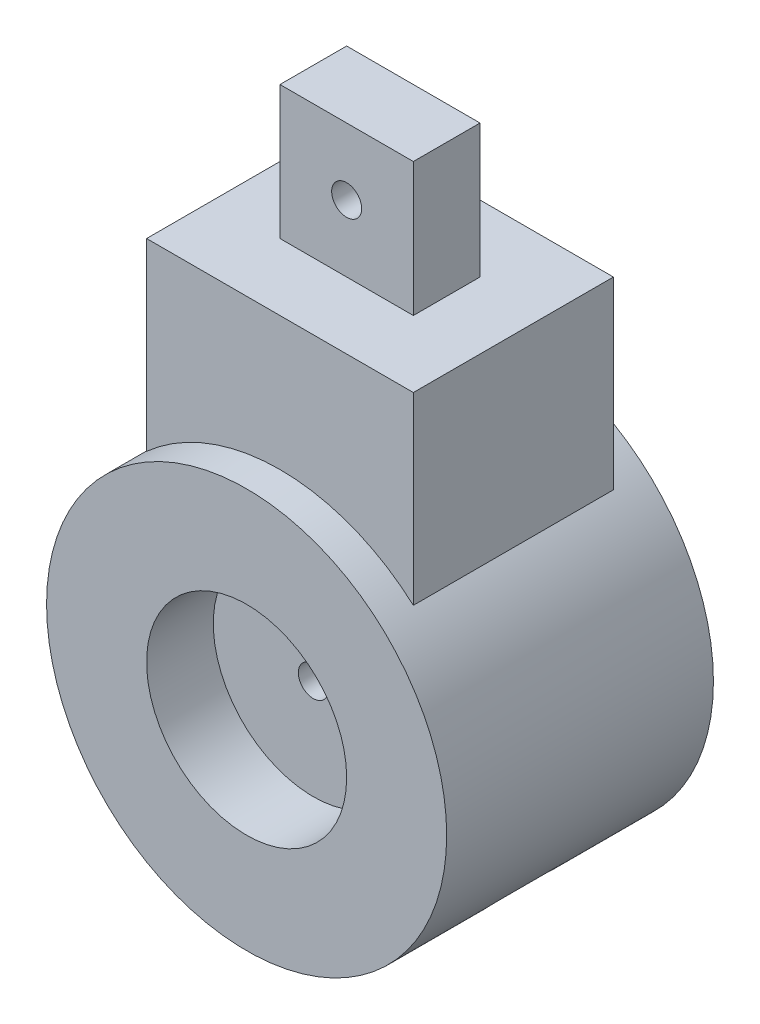
from build123d import *
from build123d.topology import SkipClean

# Parameters (mm, degrees)
SKETCH8_W               = 40
SKETCH8_H               = 50
BOSS_EXTRUDE7_DEPTH     = 15
SKETCH11_R              = 30
BOSS_EXTRUDE8_DEPTH     = 20
SKETCH14_W              = 20
SKETCH14_H              = 20
BOSS_EXTRUDE9_DEPTH     = 5
CUT_EXTRUDE6_DEPTH      = 15
CUT_EXTRUDE6_DEPTH_BACK = 29
SKETCH15_W              = 10
SKETCH15_H              = 50
SKETCH16_R              = 2.25
CUT_EXTRUDE7_DEPTH      = 62.5
SKETCH17_R              = 15
CUT_EXTRUDE8_DEPTH      = 10
SKETCH18_R              = 2.25
CUT_EXTRUDE9_DEPTH      = 31
SKETCH19_W              = 10
SKETCH19_H              = 50
CUT_EXTRUDE10_DEPTH     = 41
BOSS_EXTRUDE10_DEPTH    = 10


with BuildPart() as part:
    # Sketch8 → Boss-Extrude7 (new, symmetric)
    with BuildSketch(Plane.XY):
        with Locations((20, -25)):
            Rectangle(SKETCH8_W, SKETCH8_H)
    extrude(amount=BOSS_EXTRUDE7_DEPTH, both=True)

    # Sketch11 → Boss-Extrude8 (add, symmetric)
    with BuildSketch(Plane.XY):
        with Locations((20, -50)):
            Circle(SKETCH11_R)
    extrude(amount=BOSS_EXTRUDE8_DEPTH, both=True)

    # Sketch14 → Boss-Extrude9 (add, symmetric)
    with BuildSketch(Plane(origin=(0, 0, 0), x_dir=(-1, 0, 0), z_dir=(0, 0, -1))):
        with Locations((-20, 10)):
            Rectangle(SKETCH14_W, SKETCH14_H)
    extrude(amount=BOSS_EXTRUDE9_DEPTH, both=True)

    # Sketch15 → Cut-Extrude6 (cut, two sides: drawn at the far end of the back side and taken through both)
    with BuildSketch(Plane.ZY.offset(-CUT_EXTRUDE6_DEPTH_BACK)):
        with Locations((0, -55)):
            Rectangle(SKETCH15_W, SKETCH15_H)
    extrude(amount=CUT_EXTRUDE6_DEPTH + CUT_EXTRUDE6_DEPTH_BACK, mode=Mode.SUBTRACT)

    # Sketch16 → Cut-Extrude7 (cut, symmetric)
    with BuildSketch(Plane.XY.offset(5)):
        with Locations((20, 10)):
            Circle(SKETCH16_R)
    extrude(amount=CUT_EXTRUDE7_DEPTH, both=True, mode=Mode.SUBTRACT)

    # Sketch17 → Cut-Extrude8 (cut)
    with BuildSketch(Plane.XY.offset(20)):
        with Locations((20, -50)):
            Circle(SKETCH17_R)
    cut_extrude8 = extrude(amount=-CUT_EXTRUDE8_DEPTH, mode=Mode.SUBTRACT)

    # Sketch18 → Cut-Extrude9 (cut)
    with BuildSketch(Plane.XY.offset(10)):
        with Locations((20, -50)):
            Circle(SKETCH18_R)
    extrude(amount=-CUT_EXTRUDE9_DEPTH, mode=Mode.SUBTRACT)

    # Mirror3: Cut-Extrude8 across plane
    add(cut_extrude8.mirror(Plane(origin=(0, 0, 0), x_dir=(1, 0, 0), z_dir=(0, 0, -1))), mode=Mode.SUBTRACT)

    # Sketch19 → Cut-Extrude10 (cut)
    with BuildSketch(Plane.ZY.offset(-29)):
        with Locations((0, -55)):
            Rectangle(SKETCH19_W, SKETCH19_H)
    extrude(amount=-CUT_EXTRUDE10_DEPTH, mode=Mode.SUBTRACT)

    # Sketch20 → Boss-Extrude10 (add)
    with SkipClean():  # the faces are left unmerged after this step: merging them gives an invalid solid
        with BuildSketch(Plane(origin=(0, 0, 5), x_dir=(-1, 0, 0), z_dir=(0, 0, -1))):
            with BuildLine():
                Line((-30, -38.819660113), (-40, -27.639320225))
                ThreePointArc((-40, -27.639320225), (-49.953523925, -48.330747323), (-42.360679775, -70))
                Line((-42.360679775, -70), (-31.180339887, -60))
                ThreePointArc((-31.180339887, -60), (-34.976761962, -49.165373661), (-30, -38.819660113))
            make_face()
        extrude(amount=BOSS_EXTRUDE10_DEPTH)


solid = part.part
